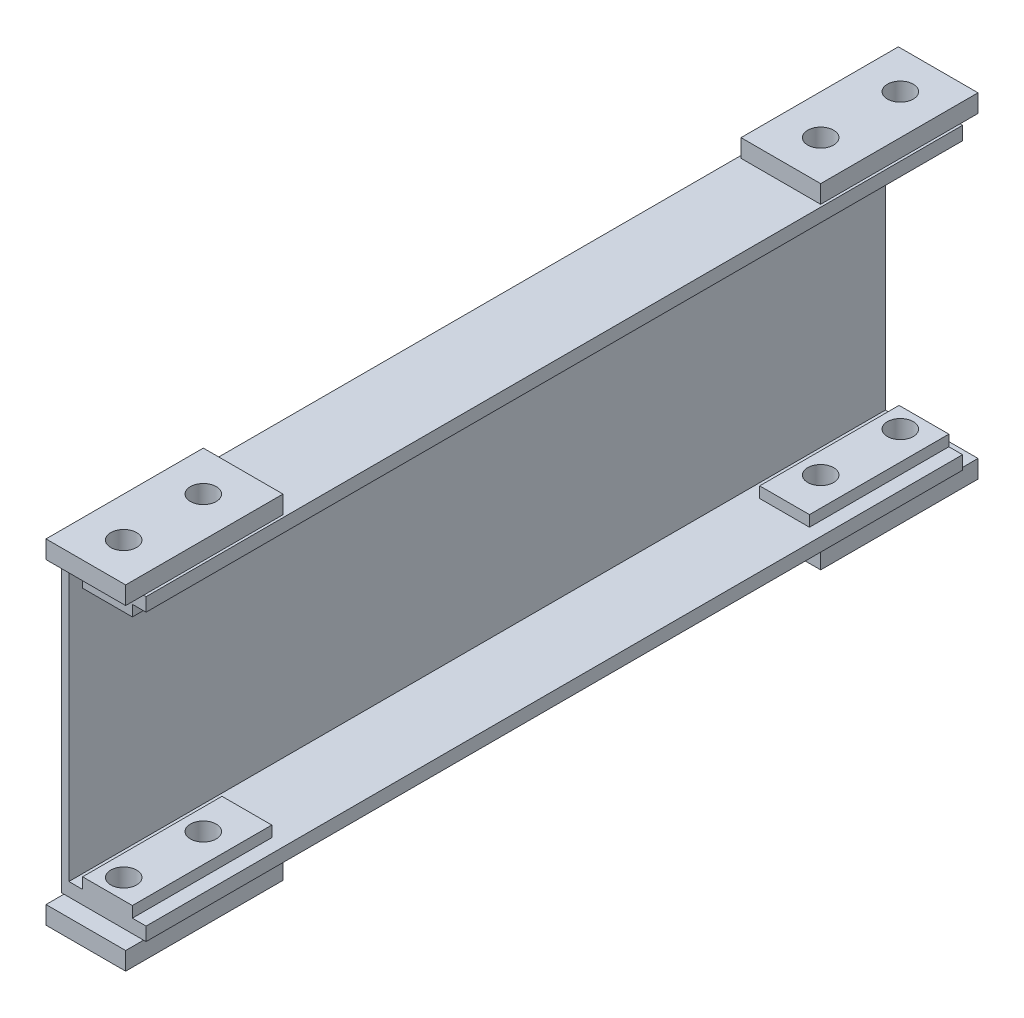
from build123d import *

# Parameters (mm, degrees)
SKETCH_1_W               = 85
SKETCH_1_H               = 300
EXTRUDE_1_DEPTH          = 820
SKETCH_2_W               = 77.5
SKETCH_2_H               = 273
CUT_EXTRUDE_1_DEPTH      = 878.282736636
SKETCH_5_W               = 50
SKETCH_5_H               = 140
EXTRUDE_3_DEPTH          = 11
SKETCH_6_W               = 80
SKETCH_6_H               = 158
EXTRUDE_4_DEPTH          = 18
SKETCH_8_R               = 13
CUT_EXTRUDE_3_DEPTH      = 884.600022635
MIRROR_4_COPY_1_SKETCH_W = 50
MIRROR_4_COPY_1_SKETCH_H = 140
MIRROR_4_COPY_1_DEPTH    = 11
MIRROR_4_COPY_2_SKETCH_W = 80
MIRROR_4_COPY_2_SKETCH_H = 158
MIRROR_4_COPY_2_DEPTH    = 18
MIRROR_4_COPY_3_SKETCH_R = 13
MIRROR_4_COPY_3_DEPTH    = 884.600022635


with BuildPart() as part:
    # 草图1 → 凸台-拉伸1 (new body)
    with BuildSketch(Plane.XY):
        with Locations((42.5, 150)):
            Rectangle(SKETCH_1_W, SKETCH_1_H)
    extrude(amount=EXTRUDE_1_DEPTH)

    # 草图2 → 切除-拉伸1 (cut, through all)
    with BuildSketch(Plane.XY.offset(820)):
        with Locations((46.25, 150)):
            Rectangle(SKETCH_2_W, SKETCH_2_H)
    extrude(amount=-CUT_EXTRUDE_1_DEPTH, mode=Mode.SUBTRACT)

    # 草图5 → 凸台-拉伸3 (add)
    with BuildSketch(Plane.XZ.offset(-286.5)):
        with Locations((46.25, 70)):
            Rectangle(SKETCH_5_W, SKETCH_5_H)
    extrude_3 = extrude(amount=EXTRUDE_3_DEPTH)

    # 草图6 → 凸台-拉伸4 (add)
    with BuildSketch(Plane(origin=(0, 300, 0), x_dir=(1, 0, 0), z_dir=(0, 1, 0))):
        with Locations((42.5, -61)):
            Rectangle(SKETCH_6_W, SKETCH_6_H)
    extrude_4 = extrude(amount=EXTRUDE_4_DEPTH)

    # 草图8 → 切除-拉伸3 (cut, through all)
    with BuildSketch(Plane(origin=(0, 318, 0), x_dir=(1, 0, 0), z_dir=(0, 1, 0))):
        with Locations((42.5, -20)):
            Circle(SKETCH_8_R)
        with Locations((42.5, -100)):
            Circle(SKETCH_8_R)
    cut_extrude_3 = extrude(amount=-CUT_EXTRUDE_3_DEPTH, mode=Mode.SUBTRACT)

    # 镜向3: 凸台-拉伸3, 凸台-拉伸4, 切除-拉伸3 across plane
    add(extrude_3.mirror(Plane(origin=(0, 150, 0), x_dir=(0, 0, 1), z_dir=(0, -1, 0))))
    add(extrude_4.mirror(Plane(origin=(0, 150, 0), x_dir=(0, 0, 1), z_dir=(0, -1, 0))))
    add(cut_extrude_3.mirror(Plane(origin=(0, 150, 0), x_dir=(0, 0, 1), z_dir=(0, -1, 0))), mode=Mode.SUBTRACT)

    # 镜向4: 凸台-拉伸3, 凸台-拉伸4, 切除-拉伸3 across plane
    add(extrude_3.mirror(Plane(origin=(0, 0, 410), x_dir=(1, 0, 0), z_dir=(0, 0, -1))))
    add(extrude_4.mirror(Plane(origin=(0, 0, 410), x_dir=(1, 0, 0), z_dir=(0, 0, -1))))
    add(cut_extrude_3.mirror(Plane(origin=(0, 0, 410), x_dir=(1, 0, 0), z_dir=(0, 0, -1))), mode=Mode.SUBTRACT)

    # 镜向4 copy 1 sketch → 镜向4 copy 1 (add)
    with BuildSketch(Plane(origin=(0, 13.5, 820), x_dir=(1, 0, 0), z_dir=(0, 1, 0))):
        with Locations((46.25, 70)):
            Rectangle(MIRROR_4_COPY_1_SKETCH_W, MIRROR_4_COPY_1_SKETCH_H)
    extrude(amount=MIRROR_4_COPY_1_DEPTH)

    # 镜向4 copy 2 sketch → 镜向4 copy 2 (add)
    with BuildSketch(Plane(origin=(0, 0, 820), x_dir=(1, 0, 0), z_dir=(0, -1, 0))):
        with Locations((42.5, -61)):
            Rectangle(MIRROR_4_COPY_2_SKETCH_W, MIRROR_4_COPY_2_SKETCH_H)
    extrude(amount=MIRROR_4_COPY_2_DEPTH)

    # 镜向4 copy 3 sketch → 镜向4 copy 3 (cut, through all)
    with BuildSketch(Plane(origin=(0, -18, 820), x_dir=(1, 0, 0), z_dir=(0, -1, 0))):
        with Locations((42.5, -20)):
            Circle(MIRROR_4_COPY_3_SKETCH_R)
        with Locations((42.5, -100)):
            Circle(MIRROR_4_COPY_3_SKETCH_R)
    extrude(amount=-MIRROR_4_COPY_3_DEPTH, mode=Mode.SUBTRACT)


solid = part.part
